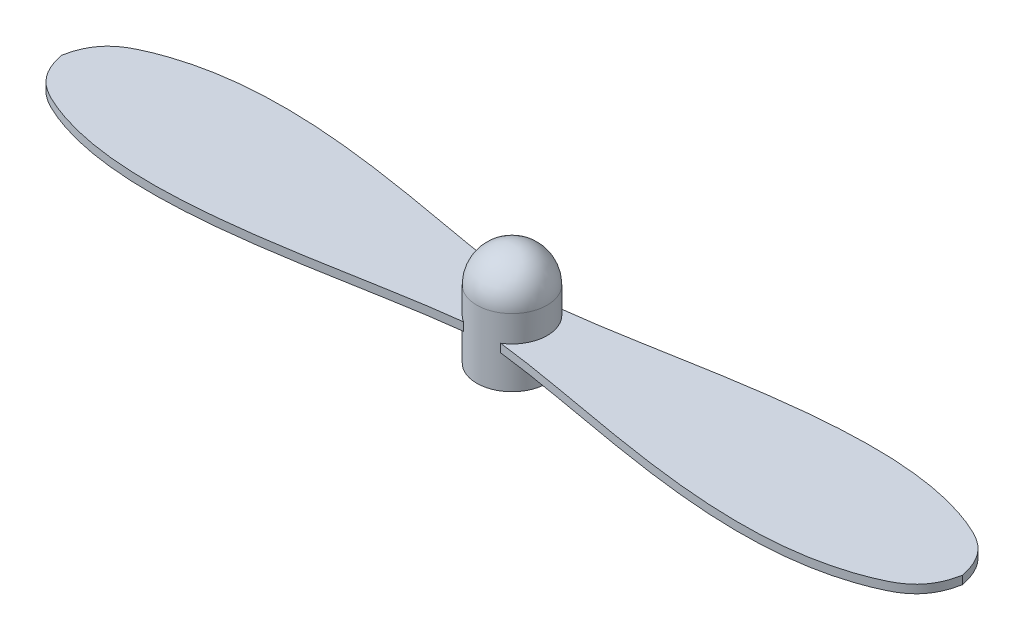
from build123d import *

# Parameters (mm, degrees)
SKETCH1_R           = 2.13
BOSS_EXTRUDE1_DEPTH = 6.22
SKETCH2_R           = 0.5
CUT_EXTRUDE1_DEPTH  = 5
FILLET1_R           = 2.13
BOSS_EXTRUDE2_DEPTH = 0.5


with BuildPart() as part:
    # Sketch1 → Boss-Extrude1 (new body)
    with BuildSketch(Plane(origin=(0, 0, 0), x_dir=(1, 0, 0), z_dir=(0, 1, 0))):
        Circle(SKETCH1_R)
    extrude(amount=BOSS_EXTRUDE1_DEPTH)

    # Sketch2 → Cut-Extrude1 (cut)
    with BuildSketch(Plane.XZ):
        Circle(SKETCH2_R)
    extrude(amount=-CUT_EXTRUDE1_DEPTH, mode=Mode.SUBTRACT)

    # Fillet1
    fillet1_edges = [part.edges().sort_by_distance(p)[0] for p in [
        (-2.13, 6.22, 0),
    ]]
    fillet(fillet1_edges, radius=FILLET1_R)

    # Sketch3 → Boss-Extrude2 (add)
    with BuildSketch(Plane(origin=(0, 2, 0), x_dir=(-1, 0, 0), z_dir=(0, -1, 0))):
        with BuildLine():
            add(Edge.make_bspline(
                [(27.225, 0), (26.883719926, -1.707588045), (19.590217869, -6.21812063), (7.79108972, -2.564670987), (1.121711894, -1.810707714)],
                knots=[0, 0, 0, 0, 0.130362346, 1, 1, 1, 1], degree=3))
            add(Edge.make_bspline(
                [(27.225, 0), (26.883719926, 1.707588045), (19.590217869, 6.21812063), (7.79108972, 2.564670987), (1.121711894, 1.810707714)],
                knots=[0, 0, 0, 0, 0.130362346, 1, 1, 1, 1], degree=3))
            ThreePointArc((1.121711894, 1.810707714), (2.13, 0), (1.121711894, -1.810707714))
        make_face()
        with BuildLine():
            add(Edge.make_bspline(
                [(-27.225, 0), (-26.883719926, 1.707588045), (-19.590217869, 6.21812063), (-7.79108972, 2.564670987), (-1.121711894, 1.810707714)],
                knots=[0, 0, 0, 0, 0.130362346, 1, 1, 1, 1], degree=3))
            add(Edge.make_bspline(
                [(-27.225, 0), (-26.883719926, -1.707588045), (-19.590217869, -6.21812063), (-7.79108972, -2.564670987), (-1.121711894, -1.810707714)],
                knots=[0, 0, 0, 0, 0.130362346, 1, 1, 1, 1], degree=3))
            ThreePointArc((-1.121711894, -1.810707714), (-2.13, 0), (-1.121711894, 1.810707714))
        make_face()
    extrude(amount=-BOSS_EXTRUDE2_DEPTH)


solid = part.part
